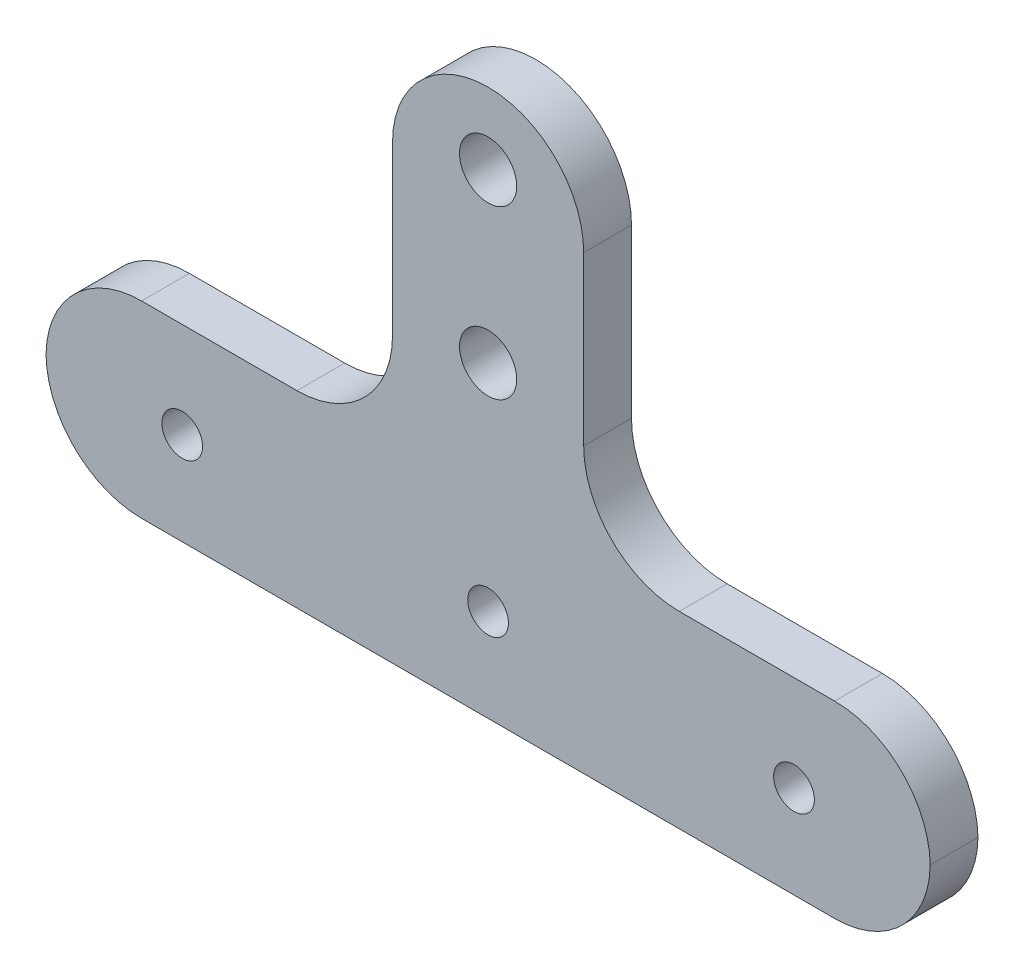
from build123d import *

# Parameters (mm, degrees)
BODY_DEPTH            = 3.175
FILLET1_R             = 6.35
F_6_32_TAPPED_HOLE1_D = 2.7051
F_6_CLEARANCE_HOLE2_D = 3.7973


with BuildPart() as part:
    # Sketch1 → Body (new body)
    with BuildSketch(Plane.XY):
        with BuildLine():
            Line((-6.35, 100.140279829), (-29.36875, 100.140279829))
            Line((-29.36875, 100.140279829), (-29.36875, 87.633226142))
            Line((-29.36875, 87.633226142), (29.36875, 87.633226142))
            Line((29.36875, 87.633226142), (29.36875, 100.140279829))
            Line((29.36875, 100.140279829), (6.35, 100.140279829))
            Line((6.35, 100.140279829), (6.35, 117.602779829))
            ThreePointArc((6.35, 117.602779829), (0, 123.952779829), (-6.35, 117.602779829))
            Line((-6.35, 117.602779829), (-6.35, 100.140279829))
        make_face()
    extrude(amount=BODY_DEPTH)

    # Fillet1
    # the kernel refuses this fillet: 6.35 mm, written as the material it adds along each edge
    with BuildSketch(Plane(origin=(6.35, 100.140279829, 0), x_dir=(1, 0, 0), z_dir=(0, 0, 1)), Plane(origin=(-6.35, 100.140279829, 0), x_dir=(0, 1, 0), z_dir=(0, 0, 1))) as fillet1_piece_1:
        with BuildLine():
            CenterArc((FILLET1_R, FILLET1_R), FILLET1_R, 180, 90)
            Line((0, FILLET1_R), (0, 0))
            Line((0, 0), (FILLET1_R, 0))
        make_face()
    extrude(amount=3.175)
    # the kernel refuses this fillet: 6.35 mm, written as the material it takes off along each edge
    with BuildSketch(Plane(origin=(29.36875, 87.633226142, -15.875), x_dir=(-1, 0, 0), z_dir=(0, 0, 1)), Plane(origin=(29.36875, 100.140279829, -15.875), x_dir=(0, -1, 0), z_dir=(0, 0, 1)), Plane(origin=(-29.36875, 100.140279829, -15.875), x_dir=(1, 0, 0), z_dir=(0, 0, 1)), Plane(origin=(-29.36875, 87.633226142, -15.875), x_dir=(0, 1, 0), z_dir=(0, 0, 1))) as fillet1_2_piece_1:
        with BuildLine():
            CenterArc((FILLET1_R, -FILLET1_R), FILLET1_R, 90, 90)
            Line((0, -FILLET1_R), (0, 0))
            Line((0, 0), (FILLET1_R, 0))
        make_face()
    extrude(amount=34.925, mode=Mode.SUBTRACT)

    # #6-32 Tapped Hole1 (through all)
    with Locations(Plane(origin=(20.32, 93.790279829, 0), x_dir=(-1, 0, 0), z_dir=(0, 0, -1))):
        with Locations((0, 0), (20.32, 0), (40.64, 0)):
            Hole(F_6_32_TAPPED_HOLE1_D / 2)

    # #6 Clearance Hole2 (through all)
    with Locations(Plane(origin=(0, 119.190279829, 0), x_dir=(-1, 0, 0), z_dir=(0, 0, -1))):
        with Locations((0, 0), (-25.4316925, 83.647585323), (0, -11.1125)):
            Hole(F_6_CLEARANCE_HOLE2_D / 2)


solid = part.part
